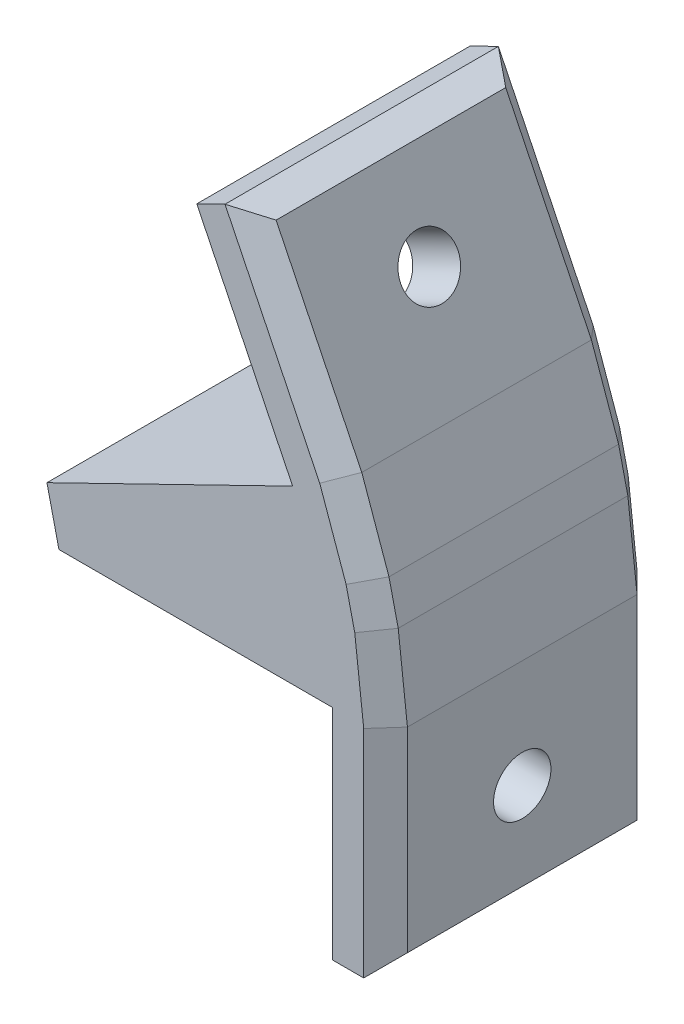
from build123d import *

# Parameters (mm, degrees)
BOSS_EXTRU_1_DEPTH      = 20
ESQUISSE2_W             = 20
ESQUISSE2_H             = 20
BOSS_EXTRU_2_DEPTH      = 2
ESQUISSE3_W             = 20
ESQUISSE3_H             = 20
BOSS_EXTRU_3_DEPTH      = 2
ESQUISSE4_W             = 20
ESQUISSE4_H             = 8.998042174
BOSS_EXTRU_4_DEPTH      = 4
BOSS_EXTRU_5_DEPTH      = 20
CHANFREIN1_SIZE         = 3
CHANFREIN2_SIZE         = 1.6
ESQUISSE7_R             = 2.1
ENL_V_MAT_EXTRU_1_DEPTH = 39.365561808
ESQUISSE8_R             = 2.1
ENL_V_MAT_EXTRU_2_DEPTH = 39.850863072
BOSS_EXTRU_6_DEPTH      = 20


with BuildPart() as part:
    # Esquisse1 → Boss.-Extru.1 (new body)
    with BuildSketch(Plane.XY):
        Polygon((0, 0), (20, 0), (17.975880926, 8.767422936), align=None)
    extrude(amount=BOSS_EXTRU_1_DEPTH)

    # Esquisse2 → Boss.-Extru.2 (add)
    with BuildSketch(Plane(origin=(0, 0, 0), x_dir=(0.8987940462991696, 0.4383711467890721, 0), z_dir=(-0.4383711467890721, 0.8987940462991696, 0))):
        with Locations((10, -10)):
            Rectangle(ESQUISSE2_W, ESQUISSE2_H)
    extrude(amount=BOSS_EXTRU_2_DEPTH)

    # Esquisse3 → Boss.-Extru.3 (add)
    with BuildSketch(Plane.XZ):
        with Locations((10, 10)):
            Rectangle(ESQUISSE3_W, ESQUISSE3_H)
    extrude(amount=BOSS_EXTRU_3_DEPTH)

    # Esquisse4 → Boss.-Extru.4 (add)
    with BuildSketch(Plane(origin=(18.987940463, 4.383711468, 0), x_dir=(0, 0, -1), z_dir=(0.9743700647852359, 0.22495105434386178, 0))):
        with Locations((-10, 0)):
            Rectangle(ESQUISSE4_W, ESQUISSE4_H)
    extrude(amount=BOSS_EXTRU_4_DEPTH)

    # Esquisse5 → Boss.-Extru.5 (add)
    with BuildSketch(Plane.XY.offset(20)):
        Polygon((17.099138632, 10.565011028), (10.085200284, 24.945715769), (13.588232336, 26.65425866), (21.873361185, 9.667227153), (17.975880926, 8.767422936), align=None)
        Polygon((20, 0), (20, -2), (20, -18), (23.897480259, -18), (23.897480259, 0.899804217), align=None)
    extrude(amount=-BOSS_EXTRU_5_DEPTH)

    # Chanfrein1
    chanfrein1_edges = [part.edges().sort_by_distance(p)[0] for p in [
        (23.897480259, 0.899804217, 10),
        (21.873361185, 9.667227153, 10),
    ]]
    chamfer(chanfrein1_edges, length=CHANFREIN1_SIZE)

    # Chanfrein2
    chanfrein2_edges = [part.edges().sort_by_distance(p)[0] for p in [
        (23.897480259, -18, 10),
        (23.897480259, -10.050097891, 0),
        (23.560053678, 0.861359315, 0),
        (22.885420722, 5.283515685, 0),
        (21.553231046, 9.553863125, 0),
        (17.073240041, 19.508933976, 0),
        (13.588232336, 26.65425866, 10),
        (17.073240041, 19.508933976, 20),
        (21.553231046, 9.553863125, 20),
        (22.885420722, 5.283515685, 20),
        (23.560053678, 0.861359315, 20),
        (23.897480259, -10.050097891, 20),
    ]]
    chamfer(chanfrein2_edges, length=CHANFREIN2_SIZE)

    # Esquisse7 → Enlèv. mat.-Extru.1 (cut, through all)
    with BuildSketch(Plane(origin=(17.975880926, 8.767422936, 0), x_dir=(0, 0, 1), z_dir=(-0.8987940462991686, -0.4383711467890744, 0))):
        with Locations((10, 10)):
            Circle(ESQUISSE7_R)
    extrude(amount=-ENL_V_MAT_EXTRU_1_DEPTH, mode=Mode.SUBTRACT)

    # Esquisse8 → Enlèv. mat.-Extru.2 (cut, through all)
    with BuildSketch(Plane.ZY.offset(-20)):
        with Locations((10, -10)):
            Circle(ESQUISSE8_R)
    extrude(amount=-ENL_V_MAT_EXTRU_2_DEPTH, mode=Mode.SUBTRACT)

    # Esquisse9 → Boss.-Extru.6 (add)
    with BuildSketch(Plane.XY.offset(20)):
        Polygon((-0.876742294, 1.797588093), (0, 0), (0, -2), align=None)
    extrude(amount=-BOSS_EXTRU_6_DEPTH)


solid = part.part
